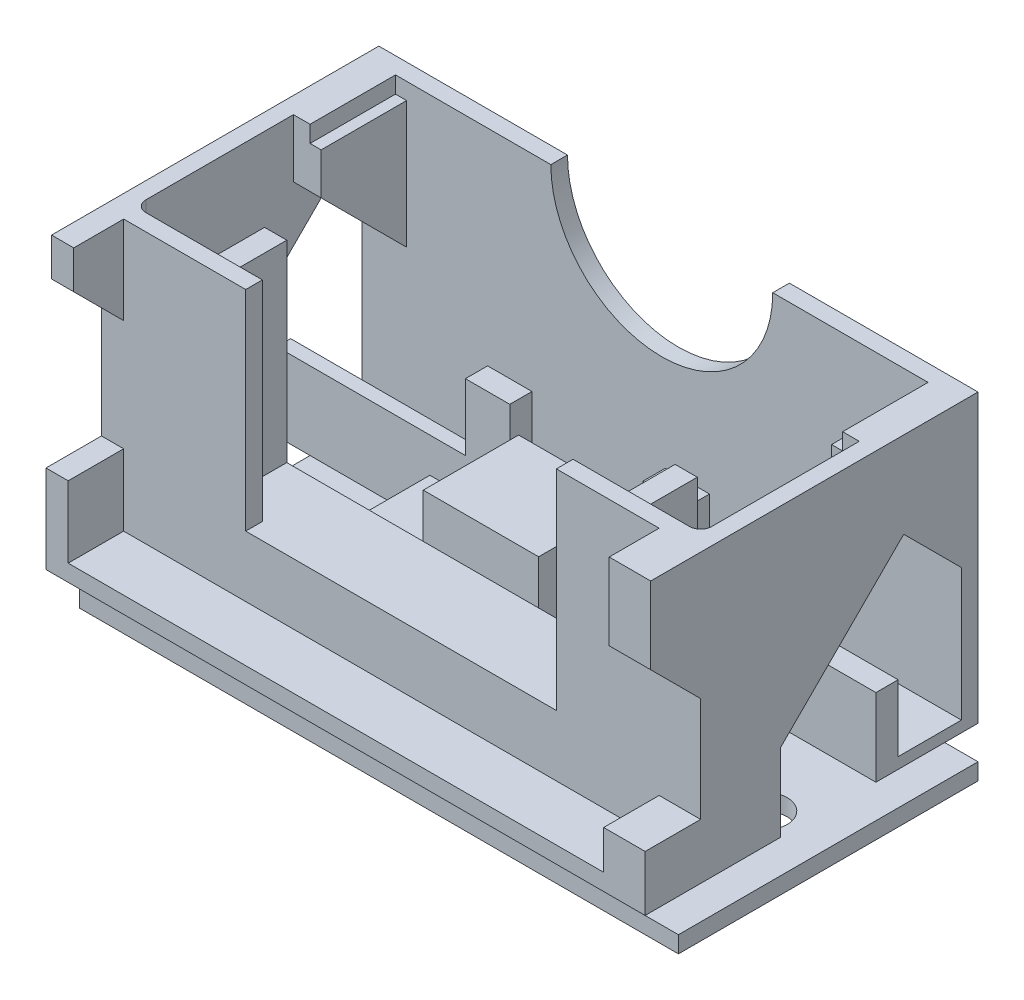
from build123d import *

# Parameters (mm, degrees)
SKETCH1_W                      = 54
SKETCH1_H                      = 27
BOSS_EXTRUDE1_DEPTH            = 1.5
CUT_EXTRUDE1_REACH             = 62.392
SKETCH2_R                      = 2.1
CUT_EXTRUDE1_DIRECTION_2_DEPTH = 61.392466418
SKETCH3_W                      = 26.4
SKETCH3_H                      = 30
BOSS_EXTRUDE2_DEPTH            = 3
CHAMFER3_SIZE                  = 3
BOSS_EXTRUDE3_DEPTH            = 7
BOSS_EXTRUDE15_START           = 7
SKETCH4_4_W                    = 10.4
SKETCH4_4_H                    = 8.6
BOSS_EXTRUDE15_DEPTH           = 4
SKETCH5_W                      = 54
SKETCH5_H                      = 1.5
BOSS_EXTRUDE5_DEPTH            = 18.86
SKETCH5_3_W                    = 2
SKETCH5_3_H                    = 5.7
BOSS_EXTRUDE6_DEPTH            = 17.36
SKETCH4_3_W                    = 8
SKETCH4_3_H                    = 8.6
BOSS_EXTRUDE12_DEPTH           = 3.86
SKETCH17_W                     = 2
SKETCH17_H                     = 6.43
SKETCH17_W_2                   = 3.74
SKETCH17_H_2                   = 3.5
BOSS_EXTRUDE13_DEPTH           = 5
SKETCH17_3_W                   = 2
SKETCH17_3_H                   = 7.93
SKETCH17_3_W_2                 = 3.74
SKETCH17_3_H_2                 = 11.43
BOSS_EXTRUDE16_DEPTH           = 4.5
CHAMFER7_SIZE                  = 4.5
SKETCH5_4_W                    = 54
SKETCH5_4_H                    = 1.5
BOSS_EXTRUDE8_DEPTH            = 18.86
BOSS_EXTRUDE9_DEPTH            = 1.5
SKETCH18_W                     = 4
SKETCH18_H                     = 7.7
BOSS_EXTRUDE14_DEPTH           = 13
CHAMFER6_SIZE                  = 7.75
SKETCH20_W                     = 1
SKETCH20_H                     = 7.7
CUT_EXTRUDE7_DEPTH             = 1.5
SKETCH12_W                     = 28
SKETCH12_H                     = 18.86
CUT_EXTRUDE2_DEPTH             = 7.2
SKETCH14_R                     = 10
CUT_EXTRUDE3_DEPTH             = 10
SKETCH15_W                     = 4
SKETCH15_H                     = 2
BOSS_EXTRUDE11_DEPTH           = 6
SKETCH21_W                     = 17
SKETCH21_H                     = 5.7
SKETCH21_H_2                   = 0.75
CUT_EXTRUDE8_DEPTH             = 6
CUT_EXTRUDE9_START             = -6
SKETCH21_3_W                   = 17
SKETCH21_3_H                   = 5.7
SKETCH21_3_H_2                 = 0.75
CUT_EXTRUDE9_DEPTH             = 1
FILLET7_R                      = 1


# Some blends are built 0.0001 mm under size
with BuildPart() as part:
    # Sketch1 → Boss-Extrude1 (new body)
    with BuildSketch(Plane(origin=(0, 0, 0), x_dir=(1, 0, 0), z_dir=(0, 1, 0))):
        with Locations((27, 13.5)):
            Rectangle(SKETCH1_W, SKETCH1_H)
    extrude(amount=BOSS_EXTRUDE1_DEPTH)

    # Sketch2 → Cut-Extrude1 (cut, up to next)
    with BuildSketch(Plane(origin=(0, 1.5, 0), x_dir=(1, 0, 0), z_dir=(0, 1, 0)), mode=Mode.PRIVATE) as cut_extrude1_sk1:
        with Locations(Location((5.8, 13.5, 0), (0, 0, 90))):
            Circle(SKETCH2_R)
    cut_extrude1_tool1 = extrude(cut_extrude1_sk1.sketch, amount=-CUT_EXTRUDE1_REACH, mode=Mode.PRIVATE) & part.part
    cut_extrude1 = cut_extrude1_tool1.solids().sort_by_distance((5.8, 1.5, -13.5))[0]
    add(cut_extrude1, mode=Mode.SUBTRACT)

    # Sketch2 → Cut-Extrude1 direction 2 (cut)
    with BuildSketch(Plane(origin=(0, 1.5, 0), x_dir=(1, 0, 0), z_dir=(0, 1, 0))):
        with Locations(Location((5.8, 13.5, 0), (0, 0, 90))):
            Circle(SKETCH2_R)
    cut_extrude1_direction_2 = extrude(amount=CUT_EXTRUDE1_DIRECTION_2_DEPTH, mode=Mode.SUBTRACT)

    # Mirror1: Cut-Extrude1, Cut-Extrude1 direction 2 across plane
    add(cut_extrude1.mirror(Plane.ZY.offset(-27)), mode=Mode.SUBTRACT)
    add(cut_extrude1_direction_2.mirror(Plane.ZY.offset(-27)), mode=Mode.SUBTRACT)

    # Sketch3 → Boss-Extrude2 (add)
    with BuildSketch(Plane(origin=(0, 1.5, 0), x_dir=(1, 0, 0), z_dir=(0, 1, 0))):
        with Locations((27, 12)):
            Rectangle(SKETCH3_W, SKETCH3_H)
    extrude(amount=BOSS_EXTRUDE2_DEPTH)

    # Chamfer3
    chamfer3_edges = [part.edges().sort_by_distance(p)[0] for p in [
        (27, 1.5, 3),
    ]]
    chamfer(chamfer3_edges, length=CHAMFER3_SIZE - 0.0001)  # a hair under: the kernel refuses the full size

    # Sketch4 → Boss-Extrude3 (add)
    with BuildSketch(Plane(origin=(0, 4.5, 0), x_dir=(1, 0, 0), z_dir=(0, 1, 0))):
        Polygon((54, 27), (0, 27), (0, 17.8), (21.8, 17.8), (21.8, 9.2), (0, 9.2), (0, 2), (54, 2), (54, 9.2), (32.2, 9.2), (32.2, 17.8), (54, 17.8), align=None)
    extrude(amount=BOSS_EXTRUDE3_DEPTH)

    # Sketch4<4> → Boss-Extrude15 (add)
    with BuildSketch(Plane(origin=(0, 4.5, 0), x_dir=(1, 0, 0), z_dir=(0, 1, 0)).offset(BOSS_EXTRUDE15_START)):
        with Locations((27, 13.5)):
            Rectangle(SKETCH4_4_W, SKETCH4_4_H)
    extrude(amount=BOSS_EXTRUDE15_DEPTH)

    # Sketch5 → Boss-Extrude5 (add)
    with BuildSketch(Plane(origin=(0, 11.5, 0), x_dir=(1, 0, 0), z_dir=(0, 1, 0))):
        with Locations((27, 2.75)):
            Rectangle(SKETCH5_W, SKETCH5_H)
    extrude(amount=BOSS_EXTRUDE5_DEPTH)

    # Sketch5<3> → Boss-Extrude6 (add)
    with BuildSketch(Plane(origin=(0, 11.5, 0), x_dir=(1, 0, 0), z_dir=(0, 1, 0))):
        with Locations((45.5, 6.35)):
            Rectangle(SKETCH5_3_W, SKETCH5_3_H)
        with Locations((8.5, 6.35)):
            Rectangle(SKETCH5_3_W, SKETCH5_3_H)
    extrude(amount=BOSS_EXTRUDE6_DEPTH)

    # Sketch4<3> → Boss-Extrude12 (add)
    with BuildSketch(Plane(origin=(0, 4.5, 0), x_dir=(1, 0, 0), z_dir=(0, 1, 0))):
        with Locations((17.8, 13.5)):
            Rectangle(SKETCH4_3_W, SKETCH4_3_H)
        with Locations((36.2, 13.5)):
            Rectangle(SKETCH4_3_W, SKETCH4_3_H)
    extrude(amount=BOSS_EXTRUDE12_DEPTH)

    # Sketch17 → Boss-Extrude13 (add)
    with BuildSketch(Plane.XY.offset(-2)):
        with Locations((1, 9.215)):
            Rectangle(SKETCH17_W, SKETCH17_H)
        Polygon((0, 6), (0, 4.5), (13.8, 4.5), (40.2, 4.5), (54, 4.5), (54, 6), (50.26, 6), (2, 6), align=None)
        with Locations((52.13, 7.75)):
            Rectangle(SKETCH17_W_2, SKETCH17_H_2)
    extrude(amount=BOSS_EXTRUDE13_DEPTH)

    # Sketch17<3> → Boss-Extrude16 (add)
    with BuildSketch(Plane.XY.offset(-2)):
        with Locations((1, 26.395)):
            Rectangle(SKETCH17_3_W, SKETCH17_3_H)
        with Locations((52.13, 24.645)):
            Rectangle(SKETCH17_3_W_2, SKETCH17_3_H_2)
    extrude(amount=BOSS_EXTRUDE16_DEPTH)

    # Chamfer7
    chamfer7_edges = [part.edges().sort_by_distance(p)[0] for p in [
        (52.13, 18.93, 2.5),
        (1, 22.43, 2.5),
    ]]
    chamfer(chamfer7_edges, length=CHAMFER7_SIZE - 0.0001)  # a hair under: the kernel refuses the full size

    # Sketch5<4> → Boss-Extrude8 (add)
    with BuildSketch(Plane(origin=(0, 11.5, 0), x_dir=(1, 0, 0), z_dir=(0, 1, 0))):
        with Locations((27, 26.25)):
            Rectangle(SKETCH5_4_W, SKETCH5_4_H)
    extrude(amount=BOSS_EXTRUDE8_DEPTH)

    # Sketch10 → Boss-Extrude9 (add)
    with BuildSketch(Plane.ZY):
        Polygon((-3.5, 11.5), (-3.5, 30.36), (-25.5, 30.36), (-25.5, 27.8), (-9.2, 11.5), align=None)
    boss_extrude9 = extrude(amount=-BOSS_EXTRUDE9_DEPTH)

    # Mirror3: Boss-Extrude9 across plane
    add(boss_extrude9.mirror(Plane.ZY.offset(-27)))

    # Sketch18 → Boss-Extrude14 (add)
    with BuildSketch(Plane(origin=(0, 30.36, 0), x_dir=(1, 0, 0), z_dir=(0, 1, 0))):
        with Locations((2, 21.65)):
            Rectangle(SKETCH18_W, SKETCH18_H)
        with Locations((52, 21.65)):
            Rectangle(SKETCH18_W, SKETCH18_H)
    extrude(amount=-BOSS_EXTRUDE14_DEPTH)

    # Chamfer6
    # the kernel refuses this chamfer: 7.75 mm, written as the material it takes off along each edge
    with BuildSketch(Plane(origin=(23.930543157, 17.36, -17.8), x_dir=(0, -0.027495876610586188, -0.9996219169112968), z_dir=(-1, 0, 0))) as chamfer6_piece_1_section:
        Polygon((CHAMFER6_SIZE * 0.999621916911, -CHAMFER6_SIZE * 0.0274958766106), (-CHAMFER6_SIZE * 0.0274958766106, -CHAMFER6_SIZE * 0.999621916911), (0, 0), align=None)
    chamfer6_piece_1 = extrude(amount=43.861086313, mode=Mode.PRIVATE)
    chamfer6_piece_1 = split(chamfer6_piece_1, bisect_by=Plane(origin=(2.75, 21.192634452, -18.892634452), z_dir=(0, -0.7071067811865515, -0.7071067811865436)), keep=Keep.TOP, mode=Mode.PRIVATE)
    chamfer6_piece_1 = split(chamfer6_piece_1, bisect_by=Plane(origin=(2.75, 19.24037252, -25.5), z_dir=(0, 0, 1)), keep=Keep.TOP, mode=Mode.PRIVATE)
    add(chamfer6_piece_1, mode=Mode.SUBTRACT)
    with BuildSketch(Plane(origin=(23.930543157, 17.36, -17.8), x_dir=(0, -0.027495876610586188, -0.9996219169112968), z_dir=(-1, 0, 0))) as chamfer6_piece_2_section:
        Polygon((CHAMFER6_SIZE * 0.999621916911, -CHAMFER6_SIZE * 0.0274958766106), (-CHAMFER6_SIZE * 0.0274958766106, -CHAMFER6_SIZE * 0.999621916911), (0, 0), align=None)
    chamfer6_piece_2 = extrude(amount=43.861086313, mode=Mode.PRIVATE)
    chamfer6_piece_2 = split(chamfer6_piece_2, bisect_by=Plane(origin=(1.5, 22.605, -18.635), z_dir=(1, 0, 0)), keep=Keep.TOP, mode=Mode.PRIVATE)
    chamfer6_piece_2 = split(chamfer6_piece_2, bisect_by=Plane(origin=(2.75, 22.605, -25.5), z_dir=(0, 0, 1)), keep=Keep.TOP, mode=Mode.PRIVATE)
    add(chamfer6_piece_2, mode=Mode.SUBTRACT)
    with BuildSketch(Plane(origin=(73.930543157, 17.36, -17.8), x_dir=(0, 0.9996219169112968, 0.027495876610586188), z_dir=(-1, 0, 0))) as chamfer6_piece_3_section:
        Polygon((CHAMFER6_SIZE * 0.999621916911, CHAMFER6_SIZE * 0.0274958766106), (-CHAMFER6_SIZE * 0.0274958766106, CHAMFER6_SIZE * 0.999621916911), (0, 0), align=None)
    chamfer6_piece_3 = extrude(amount=43.861086313, mode=Mode.PRIVATE)
    chamfer6_piece_3 = split(chamfer6_piece_3, bisect_by=Plane(origin=(53.25, 21.192634452, -18.892634452), z_dir=(0, -0.7071067811865515, -0.7071067811865436)), keep=Keep.TOP, mode=Mode.PRIVATE)
    chamfer6_piece_3 = split(chamfer6_piece_3, bisect_by=Plane(origin=(53.25, 19.24037252, -25.5), z_dir=(0, 0, 1)), keep=Keep.TOP, mode=Mode.PRIVATE)
    add(chamfer6_piece_3, mode=Mode.SUBTRACT)
    with BuildSketch(Plane(origin=(73.930543157, 17.36, -17.8), x_dir=(0, 0.9996219169112968, 0.027495876610586188), z_dir=(-1, 0, 0))) as chamfer6_piece_4_section:
        Polygon((CHAMFER6_SIZE * 0.999621916911, CHAMFER6_SIZE * 0.0274958766106), (-CHAMFER6_SIZE * 0.0274958766106, CHAMFER6_SIZE * 0.999621916911), (0, 0), align=None)
    chamfer6_piece_4 = extrude(amount=43.861086313, mode=Mode.PRIVATE)
    chamfer6_piece_4 = split(chamfer6_piece_4, bisect_by=Plane(origin=(52.5, 22.605, -18.635), z_dir=(-1, 0, 0)), keep=Keep.TOP, mode=Mode.PRIVATE)
    chamfer6_piece_4 = split(chamfer6_piece_4, bisect_by=Plane(origin=(51.25, 22.605, -25.5), z_dir=(0, 0, 1)), keep=Keep.TOP, mode=Mode.PRIVATE)
    add(chamfer6_piece_4, mode=Mode.SUBTRACT)

    # Sketch20 → Cut-Extrude7 (cut)
    with BuildSketch(Plane(origin=(0, 30.36, 0), x_dir=(1, 0, 0), z_dir=(0, 1, 0))):
        with Locations((3.5, 21.65)):
            Rectangle(SKETCH20_W, SKETCH20_H)
        with Locations((50.5, 21.65)):
            Rectangle(SKETCH20_W, SKETCH20_H)
    extrude(amount=-CUT_EXTRUDE7_DEPTH, mode=Mode.SUBTRACT)

    # Sketch12 → Cut-Extrude2 (cut)
    with BuildSketch(Plane.XY.offset(-2)):
        with Locations((27, 20.93)):
            Rectangle(SKETCH12_W, SKETCH12_H)
    extrude(amount=-CUT_EXTRUDE2_DEPTH, mode=Mode.SUBTRACT)

    # Sketch14 → Cut-Extrude3 (cut)
    with BuildSketch(Plane(origin=(0, 0, -27), x_dir=(-1, 0, 0), z_dir=(0, 0, -1))):
        with Locations((-27, 30.36)):
            Circle(SKETCH14_R)
    extrude(amount=-CUT_EXTRUDE3_DEPTH, mode=Mode.SUBTRACT)

    # Sketch15 → Boss-Extrude11 (add)
    with BuildSketch(Plane(origin=(0, 11.5, 0), x_dir=(1, 0, 0), z_dir=(0, 1, 0))):
        with Locations((19, 18.8)):
            Rectangle(SKETCH15_W, SKETCH15_H)
    boss_extrude11 = extrude(amount=BOSS_EXTRUDE11_DEPTH)

    # Mirror5: Boss-Extrude11 across plane
    add(boss_extrude11.mirror(Plane.ZY.offset(-27)))

    # Sketch21 → Cut-Extrude8 (cut)
    with BuildSketch(Plane(origin=(0, 11.5, 0), x_dir=(1, 0, 0), z_dir=(0, 1, 0))):
        Polygon((54, 25.5), (17, 25.5), (17, 19.8), (21, 19.8), (33, 19.8), (37, 19.8), (54, 19.8), align=None)
        with Locations((8.5, 22.65)):
            Rectangle(SKETCH21_W, SKETCH21_H)
        with Locations((8.5, 19.425)):
            Rectangle(SKETCH21_W, SKETCH21_H_2)
    extrude(amount=-CUT_EXTRUDE8_DEPTH, mode=Mode.SUBTRACT)

    # Sketch21<3> → Cut-Extrude9 (cut)
    with BuildSketch(Plane(origin=(0, 11.5, 0), x_dir=(1, 0, 0), z_dir=(0, 1, 0)).offset(CUT_EXTRUDE9_START)):
        with Locations((8.5, 22.65)):
            Rectangle(SKETCH21_3_W, SKETCH21_3_H)
        with Locations((8.5, 19.425)):
            Rectangle(SKETCH21_3_W, SKETCH21_3_H_2)
    extrude(amount=-CUT_EXTRUDE9_DEPTH, mode=Mode.SUBTRACT)

    # Fillet7
    fillet7_edges = [part.edges().sort_by_distance(p)[0] for p in [
        (1.5, 20.93, -3.5),
        (52.5, 20.93, -3.5),
    ]]
    fillet(fillet7_edges, radius=FILLET7_R)


solid = part.part
